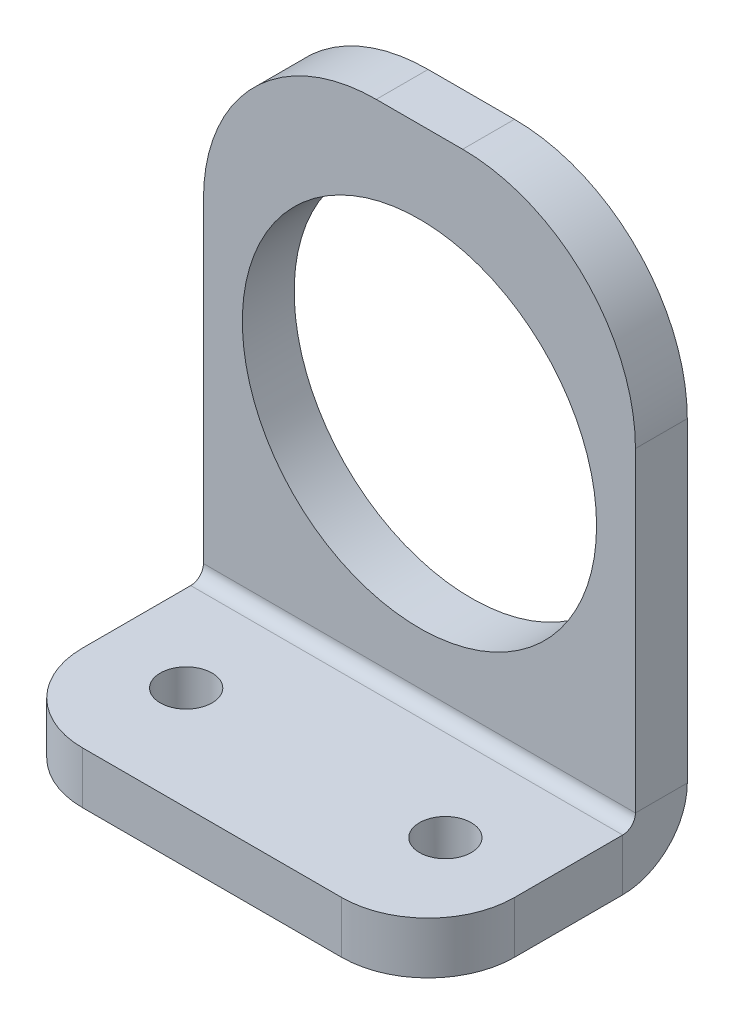
from build123d import *

# Parameters (mm, degrees)
SKETCH_1_W                       = 25
SKETCH_1_H                       = 32
SM_BASE_FLANGE_1_DEPTH           = 3
SM_EDGE_FLANGE_1_STRIP_W         = 13.4732
SM_EDGE_FLANGE_1_STRIP_H         = 3
SM_EDGE_FLANGE_1_STRIP_CUT_DEPTH = 25
SM_EDGE_FLANGE_1_DEPTH           = 25
SKETCH_13_R                      = 10.25
CUT_EXTRUDE_1_DEPTH              = 10
SKETCH_15_R                      = 1.5
CUT_EXTRUDE_2_DEPTH              = 10
FILLET_1_R                       = 10
FILLET_2_R                       = 5


# Sheet-metal steps are written as plain solids
with BuildPart() as part:
    # Sketch 1 → 基体-法兰1 (new body)
    with BuildSketch(Plane.XY):
        Rectangle(SKETCH_1_W, SKETCH_1_H)
    extrude(amount=-SM_BASE_FLANGE_1_DEPTH)

    # 边线-法兰1 strip (across the edge) → 边线-法兰1 strip cut (cut)
    with BuildSketch(Plane(origin=(-12.5, -16, 0), x_dir=(0, 1, 0), z_dir=(1, 0, 0))):
        with Locations((-3, -1.5)):
            Rectangle(SM_EDGE_FLANGE_1_STRIP_W, SM_EDGE_FLANGE_1_STRIP_H)
    extrude(amount=SM_EDGE_FLANGE_1_STRIP_CUT_DEPTH, mode=Mode.SUBTRACT)

    # 边线-法兰1 section (across the edge) → 边线-法兰1 (add)
    with BuildSketch(Plane(origin=(-12.5, -16, 0), x_dir=(0, 1, 0), z_dir=(1, 0, 0))):
        with BuildLine():
            Line((0, 0.7366), (0, 12))
            Line((0, 12), (3, 12))
            Line((3, 12), (3, 0.7366))
            ThreePointArc((3, 0.7366), (3.215745145, 0.215745145), (3.7366, 0))
            Line((3.7366, 0), (3.7366, -3))
            ThreePointArc((3.7366, -3), (1.094424801, -1.905575199), (0, 0.7366))
        make_face()
    extrude(amount=SM_EDGE_FLANGE_1_DEPTH)

    # 草图13 → 切除-拉伸1 (cut)
    with BuildSketch(Plane.XY):
        with Locations((0, 1)):
            Circle(SKETCH_13_R)
    extrude(amount=-CUT_EXTRUDE_1_DEPTH, mode=Mode.SUBTRACT)

    # 草图15 → 切除-拉伸2 (cut)
    with BuildSketch(Plane(origin=(0, -13, 0), x_dir=(1, 0, 0), z_dir=(0, 1, 0))):
        with Locations(Location((-7.5, -6, 0), (0, 0, 270))):
            Circle(SKETCH_15_R)
        with Locations(Location((7.5, -6, 0), (0, 0, 270))):
            Circle(SKETCH_15_R)
    extrude(amount=-CUT_EXTRUDE_2_DEPTH, mode=Mode.SUBTRACT)

    # 圆角1
    fillet_1_edges = [part.edges().sort_by_distance(p)[0] for p in [
        (-12.5, 16, -1.5),
        (12.5, 16, -1.5),
    ]]
    fillet(fillet_1_edges, radius=FILLET_1_R)

    # 圆角2
    fillet_2_edges = [part.edges().sort_by_distance(p)[0] for p in [
        (-12.5, -14.5, 12),
        (12.5, -14.5, 12),
    ]]
    fillet(fillet_2_edges, radius=FILLET_2_R)


solid = part.part
